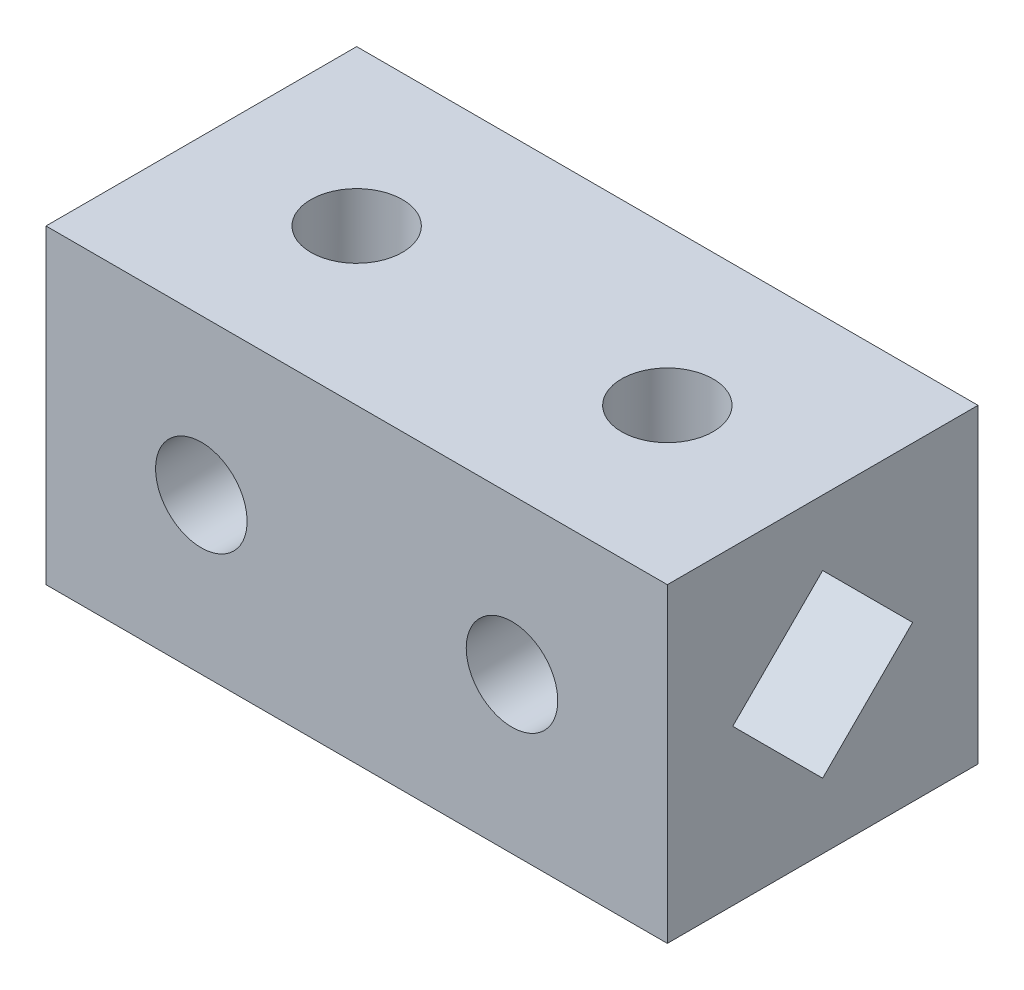
from build123d import *

# Parameters (mm, degrees)
SKETCH1_W           = 34
SKETCH1_H           = 17
SKETCH1_R           = 2.505
BOSS_EXTRUDE1_DEPTH = 17
SKETCH6_OUTSIDE_W   = 44.328
SKETCH6_OUTSIDE_H   = 27.328
SKETCH6_OUTSIDE_W_2 = 34
SKETCH6_OUTSIDE_H_2 = 17
SKETCH6_OUTSIDE_R   = 2.505
CUT_EXTRUDE10_DEPTH = 42.641325627
SKETCH7_OUTSIDE_W   = 27.328
SKETCH7_OUTSIDE_H   = 27.328
SKETCH7_OUTSIDE_W_2 = 17
SKETCH7_OUTSIDE_H_2 = 17
CUT_EXTRUDE11_DEPTH = 34


with BuildPart() as part:
    # sketch1 → Boss-Extrude1 (new body)
    with BuildSketch(Plane(origin=(0, 0, 0), x_dir=(1, 0, 0), z_dir=(0, 1, 0))):
        with Locations((17, -8.5)):
            Rectangle(SKETCH1_W, SKETCH1_H)
        with Locations((8.5, -8.5)):
            Circle(SKETCH1_R, mode=Mode.SUBTRACT)
        with Locations((25.5, -8.5)):
            Circle(SKETCH1_R, mode=Mode.SUBTRACT)
    extrude(amount=BOSS_EXTRUDE1_DEPTH)

    # Sketch6 outside → Cut-Extrude10 (cut, through all)
    # profile 1 of 3: a face of its own
    with BuildSketch(Plane(origin=(0, 0, 0), x_dir=(-1, 0, 0), z_dir=(0, 0, -1))):
        with Locations((-17, 8.5)):
            Rectangle(SKETCH6_OUTSIDE_W, SKETCH6_OUTSIDE_H)
        with Locations((-17, 8.5)):
            Rectangle(SKETCH6_OUTSIDE_W_2, SKETCH6_OUTSIDE_H_2, mode=Mode.SUBTRACT)
    # profile 2 of 3: a face of its own
    with BuildSketch(Plane(origin=(0, 0, 0), x_dir=(-1, 0, 0), z_dir=(0, 0, -1))):
        with Locations((-25.5, 8.5)):
            Circle(SKETCH6_OUTSIDE_R)
    # profile 3 of 3: a face of its own
    with BuildSketch(Plane(origin=(0, 0, 0), x_dir=(-1, 0, 0), z_dir=(0, 0, -1))):
        with Locations((-8.5, 8.5)):
            Circle(SKETCH6_OUTSIDE_R)
    extrude(amount=-CUT_EXTRUDE10_DEPTH, mode=Mode.SUBTRACT)

    # Sketch7 outside → Cut-Extrude11 (cut)
    # profile 1 of 2: a face of its own
    with BuildSketch(Plane(origin=(34, 0, 0), x_dir=(0, 0, -1), z_dir=(1, 0, 0))):
        with Locations((-8.5, 8.5)):
            Rectangle(SKETCH7_OUTSIDE_W, SKETCH7_OUTSIDE_H)
        with Locations((-8.5, 8.5)):
            Rectangle(SKETCH7_OUTSIDE_W_2, SKETCH7_OUTSIDE_H_2, mode=Mode.SUBTRACT)
    # profile 2 of 2: a face of its own
    with BuildSketch(Plane(origin=(34, 0, 0), x_dir=(0, 0, -1), z_dir=(1, 0, 0))):
        Polygon((-8.5, 13.421463197), (-3.578536803, 8.5), (-8.5, 3.578536803), (-13.421463197, 8.5), align=None)
    extrude(amount=-CUT_EXTRUDE11_DEPTH, mode=Mode.SUBTRACT)


solid = part.part
